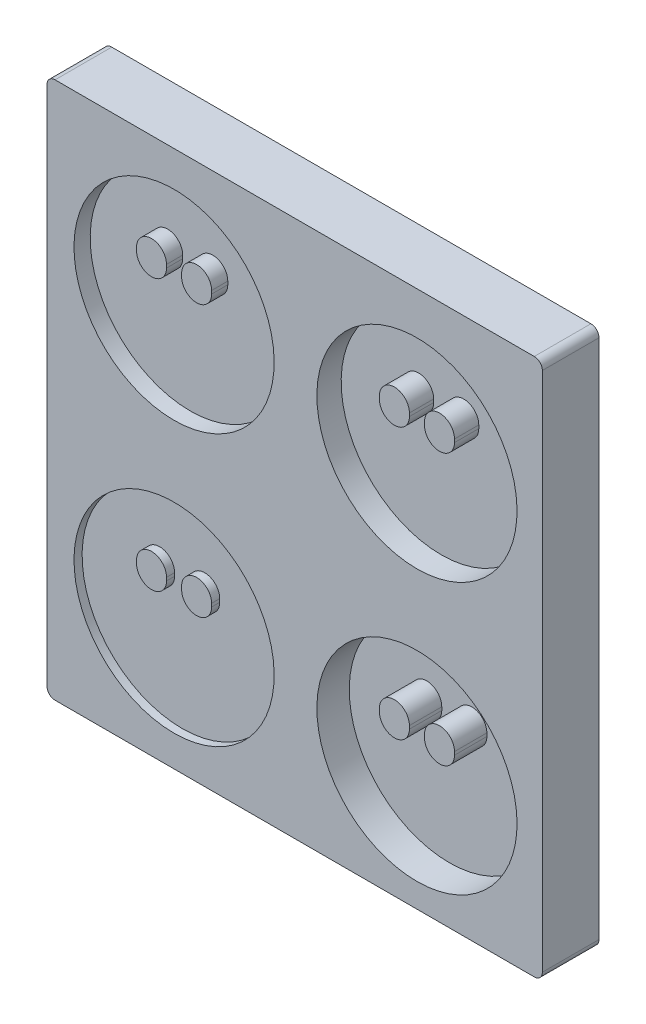
from build123d import *

# Parameters (mm, degrees)
BOSS_EXTRUDE1_DEPTH = 7
CAVITY1_START       = -3
CAVITY1_OUTLINE_R   = 12.36
CAVITY1_DEPTH       = 3
CAVITY1_START_2     = -2
CAVITY1_2_OUTLINE_R = 12.36
CAVITY1_2_DEPTH     = 2
CAVITY1_START_3     = -4
CAVITY1_3_OUTLINE_R = 12.36
CAVITY1_3_DEPTH     = 1
CAVITY1_START_4     = -1
CAVITY1_4_OUTLINE_R = 12.36
CAVITY1_4_DEPTH     = 1


# Read off the part's stored shape, not the designer's step: Cavity1
with BuildPart() as part:
    # Sketch1 → Boss-Extrude1 (new body)
    with BuildSketch(Plane.XY):
        with BuildLine():
            Line((38.123582206, -19.216804324), (-21.063563238, -19.216804324))
            ThreePointArc((-21.063563238, -19.216804324), (-21.770670019, -18.923911105), (-22.063563238, -18.216804324))
            Line((-22.063563238, -18.216804324), (-22.063563238, 46.15189529))
            ThreePointArc((-22.063563238, 46.15189529), (-21.770670019, 46.859002071), (-21.063563238, 47.15189529))
            Line((-21.063563238, 47.15189529), (38.123582206, 47.15189529))
            ThreePointArc((38.123582206, 47.15189529), (38.830688987, 46.859002071), (39.123582206, 46.15189529))
            Line((39.123582206, 46.15189529), (39.123582206, -18.216804324))
            ThreePointArc((39.123582206, -18.216804324), (38.830688987, -18.923911105), (38.123582206, -19.216804324))
        make_face()
    extrude(amount=-BOSS_EXTRUDE1_DEPTH)

    # Cavity1 outline → Cavity1 (cut)
    # profile 1 of 2: a face of its own
    with BuildSketch(Plane.XY.offset(CAVITY1_START)):
        with Locations((23.634896534, -3.890788044)):
            Circle(CAVITY1_OUTLINE_R)
        with BuildLine():
            ThreePointArc((18.999896534, -0.040788044), (20.849896534, 1.809211956), (22.699896534, -0.040788044))
            Line((22.699896534, -0.040788044), (22.699896534, -0.430788044))
            ThreePointArc((22.699896534, -0.430788044), (20.849896534, -2.280788044), (18.999896534, -0.430788044))
            Line((18.999896534, -0.430788044), (18.999896534, -0.040788044))
        make_face(mode=Mode.SUBTRACT)
        with BuildLine():
            ThreePointArc((24.569896534, -0.040788044), (26.419896534, 1.809211956), (28.269896534, -0.040788044))
            Line((28.269896534, -0.040788044), (28.269896534, -0.430788044))
            ThreePointArc((28.269896534, -0.430788044), (26.419896534, -2.280788044), (24.569896534, -0.430788044))
            Line((24.569896534, -0.430788044), (24.569896534, -0.040788044))
        make_face(mode=Mode.SUBTRACT)
    # profile 2 of 2: a face of its own
    with BuildSketch(Plane.XY.offset(CAVITY1_START)):
        with Locations((23.634896534, 29.54740971)):
            Circle(CAVITY1_OUTLINE_R)
        with BuildLine():
            Line((22.699896534, 33.39740971), (22.699896534, 33.00740971))
            ThreePointArc((22.699896534, 33.00740971), (20.849896534, 31.15740971), (18.999896534, 33.00740971))
            Line((18.999896534, 33.00740971), (18.999896534, 33.39740971))
            ThreePointArc((18.999896534, 33.39740971), (20.849896534, 35.24740971), (22.699896534, 33.39740971))
        make_face(mode=Mode.SUBTRACT)
        with BuildLine():
            Line((28.269896534, 33.39740971), (28.269896534, 33.00740971))
            ThreePointArc((28.269896534, 33.00740971), (26.419896534, 31.15740971), (24.569896534, 33.00740971))
            Line((24.569896534, 33.00740971), (24.569896534, 33.39740971))
            ThreePointArc((24.569896534, 33.39740971), (26.419896534, 35.24740971), (28.269896534, 33.39740971))
        make_face(mode=Mode.SUBTRACT)
    extrude(amount=CAVITY1_DEPTH, mode=Mode.SUBTRACT)

    # Cavity1 2 outline → Cavity1 2 (cut)
    with BuildSketch(Plane.XY.offset(CAVITY1_START_2)):
        with Locations((-6.365103466, 30.435007788)):
            Circle(CAVITY1_2_OUTLINE_R)
        with BuildLine():
            ThreePointArc((-11.000103466, 34.285007788), (-9.150103466, 36.135007788), (-7.300103466, 34.285007788))
            Line((-7.300103466, 34.285007788), (-7.300103466, 33.895007788))
            ThreePointArc((-7.300103466, 33.895007788), (-9.150103466, 32.045007788), (-11.000103466, 33.895007788))
            Line((-11.000103466, 33.895007788), (-11.000103466, 34.285007788))
        make_face(mode=Mode.SUBTRACT)
        with BuildLine():
            ThreePointArc((-5.430103466, 34.285007788), (-3.580103466, 36.135007788), (-1.730103466, 34.285007788))
            Line((-1.730103466, 34.285007788), (-1.730103466, 33.895007788))
            ThreePointArc((-1.730103466, 33.895007788), (-3.580103466, 32.045007788), (-5.430103466, 33.895007788))
            Line((-5.430103466, 33.895007788), (-5.430103466, 34.285007788))
        make_face(mode=Mode.SUBTRACT)
    extrude(amount=CAVITY1_2_DEPTH, mode=Mode.SUBTRACT)

    # Cavity1 3 outline → Cavity1 3 (cut)
    with BuildSketch(Plane.XY.offset(CAVITY1_START_3)):
        with Locations((23.634896534, -3.890788044)):
            Circle(CAVITY1_3_OUTLINE_R)
        with BuildLine():
            ThreePointArc((18.999896534, -0.040788044), (20.849896534, 1.809211956), (22.699896534, -0.040788044))
            Line((22.699896534, -0.040788044), (22.699896534, -0.430788044))
            ThreePointArc((22.699896534, -0.430788044), (20.849896534, -2.280788044), (18.999896534, -0.430788044))
            Line((18.999896534, -0.430788044), (18.999896534, -0.040788044))
        make_face(mode=Mode.SUBTRACT)
        with BuildLine():
            ThreePointArc((24.569896534, -0.040788044), (26.419896534, 1.809211956), (28.269896534, -0.040788044))
            Line((28.269896534, -0.040788044), (28.269896534, -0.430788044))
            ThreePointArc((28.269896534, -0.430788044), (26.419896534, -2.280788044), (24.569896534, -0.430788044))
            Line((24.569896534, -0.430788044), (24.569896534, -0.040788044))
        make_face(mode=Mode.SUBTRACT)
    extrude(amount=CAVITY1_3_DEPTH, mode=Mode.SUBTRACT)

    # Cavity1 4 outline → Cavity1 4 (cut)
    with BuildSketch(Plane.XY.offset(CAVITY1_START_4)):
        with Locations((-6.365103466, -3.03425393)):
            Circle(CAVITY1_4_OUTLINE_R)
        with BuildLine():
            Line((-7.300103466, 0.81574607), (-7.300103466, 0.42574607))
            ThreePointArc((-7.300103466, 0.42574607), (-9.150103466, -1.42425393), (-11.000103466, 0.42574607))
            Line((-11.000103466, 0.42574607), (-11.000103466, 0.81574607))
            ThreePointArc((-11.000103466, 0.81574607), (-9.150103466, 2.66574607), (-7.300103466, 0.81574607))
        make_face(mode=Mode.SUBTRACT)
        with BuildLine():
            Line((-1.730103466, 0.81574607), (-1.730103466, 0.42574607))
            ThreePointArc((-1.730103466, 0.42574607), (-3.580103466, -1.42425393), (-5.430103466, 0.42574607))
            Line((-5.430103466, 0.42574607), (-5.430103466, 0.81574607))
            ThreePointArc((-5.430103466, 0.81574607), (-3.580103466, 2.66574607), (-1.730103466, 0.81574607))
        make_face(mode=Mode.SUBTRACT)
    extrude(amount=CAVITY1_4_DEPTH, mode=Mode.SUBTRACT)


solid = part.part
